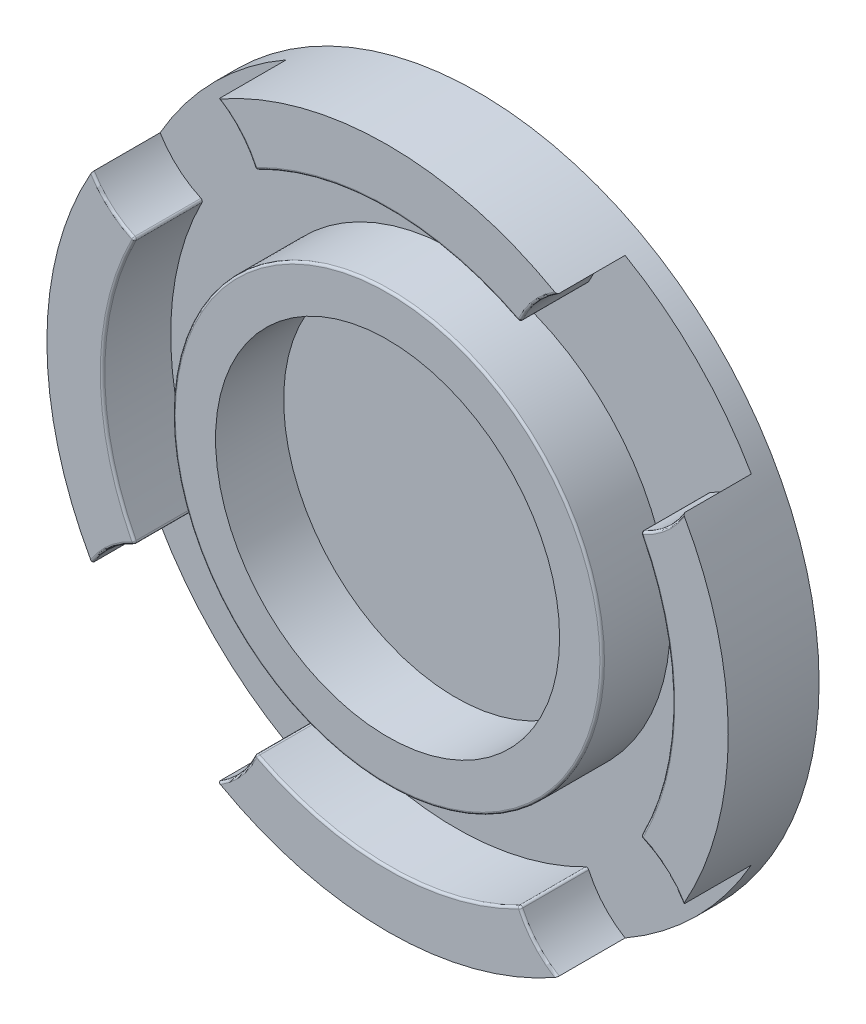
from build123d import *

# Parameters (mm, degrees)
BOSS_EXTRUDE1_DEPTH   = 3
BOSS_EXTRUDE1_2_DEPTH = 3
BOSS_EXTRUDE1_3_DEPTH = 3
BOSS_EXTRUDE1_4_DEPTH = 3
SKETCH1_R             = 9.45
SKETCH1_R_2           = 7.575
BOSS_EXTRUDE1_5_DEPTH = 3
BOSS_EXTRUDE2_START   = -1
SKETCH2_R             = 15
BOSS_EXTRUDE2_DEPTH   = 1
FILLET1_R             = 0.1
FILLET2_R             = 0.1


with BuildPart() as part:
    # Sketch1 → Boss-Extrude1 (new body)
    with BuildSketch(Plane.XY):
        with BuildLine():
            ThreePointArc((5.814987036, 11.121529831), (6.485587296, 12.198625444), (7.456549067, 13.01537076))
            ThreePointArc((7.456549067, 13.01537076), (0, 15), (-7.456549067, 13.01537076))
            ThreePointArc((-7.456549067, 13.01537076), (-6.485587296, 12.198625444), (-5.814987036, 11.121529831))
            ThreePointArc((-5.814987036, 11.121529831), (0, 12.55), (5.814987036, 11.121529831))
        make_face()
    extrude(amount=BOSS_EXTRUDE1_DEPTH)



with BuildPart() as body_2:
    # Sketch1 → Boss-Extrude1 2 (new body)
    with BuildSketch(Plane.XY):
        with BuildLine():
            ThreePointArc((13.01537076, -7.456549067), (14.495353762, -3.858071967), (15, 0))
            ThreePointArc((15, 0), (14.495353762, 3.858071967), (13.01537076, 7.456549067))
            ThreePointArc((13.01537076, 7.456549067), (12.198625444, 6.485587296), (11.121529831, 5.814987036))
            ThreePointArc((11.121529831, 5.814987036), (12.55, 0), (11.121529831, -5.814987036))
            ThreePointArc((11.121529831, -5.814987036), (12.198625444, -6.485587296), (13.01537076, -7.456549067))
        make_face()
    extrude(amount=BOSS_EXTRUDE1_2_DEPTH)


with BuildPart() as body_3:
    # Sketch1 → Boss-Extrude1 3 (new body)
    with BuildSketch(Plane.XY):
        with BuildLine():
            ThreePointArc((-7.456549067, -13.01537076), (0, -15), (7.456549067, -13.01537076))
            ThreePointArc((7.456549067, -13.01537076), (6.485587296, -12.198625444), (5.814987036, -11.121529831))
            ThreePointArc((5.814987036, -11.121529831), (0, -12.55), (-5.814987036, -11.121529831))
            ThreePointArc((-5.814987036, -11.121529831), (-6.485587296, -12.198625444), (-7.456549067, -13.01537076))
        make_face()
    extrude(amount=BOSS_EXTRUDE1_3_DEPTH)


with BuildPart() as body_4:
    # Sketch1 → Boss-Extrude1 4 (new body)
    with BuildSketch(Plane.XY):
        with BuildLine():
            ThreePointArc((-11.121529831, 5.814987036), (-12.198625444, 6.485587296), (-13.01537076, 7.456549067))
            ThreePointArc((-13.01537076, 7.456549067), (-15, 0), (-13.01537076, -7.456549067))
            ThreePointArc((-13.01537076, -7.456549067), (-12.198625444, -6.485587296), (-11.121529831, -5.814987036))
            ThreePointArc((-11.121529831, -5.814987036), (-12.55, 0), (-11.121529831, 5.814987036))
        make_face()
    extrude(amount=BOSS_EXTRUDE1_4_DEPTH)


with BuildPart() as body_5:
    # Sketch1 → Boss-Extrude1 5 (new body)
    with BuildSketch(Plane.XY):
        Circle(SKETCH1_R)
        Circle(SKETCH1_R_2, mode=Mode.SUBTRACT)
    extrude(amount=BOSS_EXTRUDE1_5_DEPTH)


with BuildPart() as part_1:
    add(part.part)

    add(body_2.part)  # Boss-Extrude2 merges body 2

    add(body_3.part)  # Boss-Extrude2 merges body 3

    add(body_4.part)  # Boss-Extrude2 merges body 4

    add(body_5.part)  # Boss-Extrude2 merges body 5
    # Sketch2 → Boss-Extrude2 (add)
    with BuildSketch(Plane.XY.offset(BOSS_EXTRUDE2_START)):
        with Locations(Location((0, 0, 0), (0, 0, 150.191461703))):
            Circle(SKETCH2_R)
    extrude(amount=BOSS_EXTRUDE2_DEPTH)

    # Fillet1
    fillet1_edges = [part_1.edges().sort_by_distance(p)[0] for p in [
        (11.121529831, 5.814987036, 1.5),
        (11.121529831, -5.814987036, 1.5),
        (5.814987036, -11.121529831, 1.5),
        (-5.814987036, -11.121529831, 1.5),
        (-11.121529831, -5.814987036, 1.5),
        (-11.121529831, 5.814987036, 1.5),
        (5.814987036, 11.121529831, 1.5),
        (-5.814987036, 11.121529831, 1.5),
    ]]
    fillet(fillet1_edges, radius=FILLET1_R)

    # Fillet2
    fillet2_edges = [part_1.edges().sort_by_distance(p)[0] for p in [
        (6.520367717, 12.238227379, 3),
        (12.238227379, -6.520367717, 3),
        (-6.520367717, -12.238227379, 3),
        (-12.238227379, 6.520367717, 3),
        (-9.45, 0, 3),
        (0, -12.55, 3),
        (6.520367717, -12.238227379, 3),
        (5.799143147, -11.164972845, 3),
        (-5.799143147, -11.164972845, 3),
        (12.55, 0, 3),
        (12.238227379, 6.520367717, 3),
        (11.164972845, 5.799143147, 3),
        (11.164972845, -5.799143147, 3),
        (0, 12.55, 3),
        (-6.520367717, 12.238227379, 3),
        (-5.799143147, 11.164972845, 3),
        (5.799143147, 11.164972845, 3),
        (-12.55, 0, 3),
        (-12.238227379, -6.520367717, 3),
        (-11.164972845, -5.799143147, 3),
        (-11.164972845, 5.799143147, 3),
    ]]
    fillet(fillet2_edges, radius=FILLET2_R - 0.0001)  # a hair under: the kernel refuses the full size


solid = part_1.part
